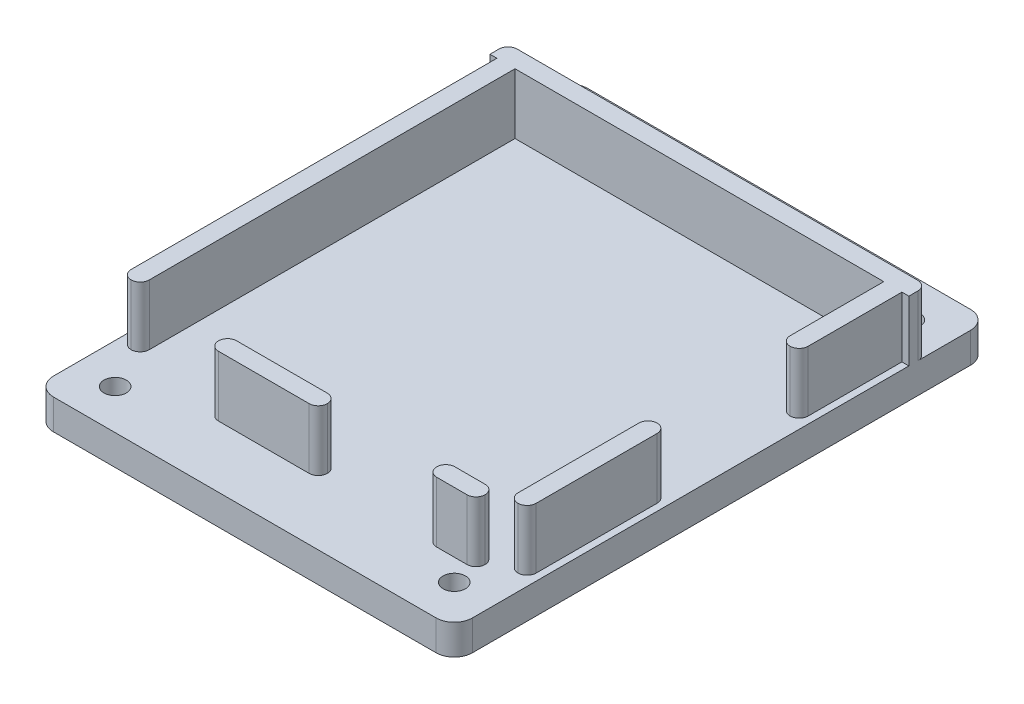
from build123d import *

# Parameters (mm, degrees)
SKETCH_1_W      = 69.3
SKETCH_1_H      = 88.4
SKETCH_1_R      = 1.85
EXTRUDE_1_DEPTH = 5
SKETCH_3_W      = 69.3
SKETCH_3_H      = 3
SKETCH_3_W_2    = 8
SKETCH_3_W_3    = 18
EXTRUDE_2_DEPTH = 10
SKETCH_4_W      = 3
SKETCH_4_H      = 62
SKETCH_4_H_2    = 17
SKETCH_4_H_3    = 23
EXTRUDE_3_DEPTH = 10
FILLET_1_R      = 3
FILLET_2_R      = 1.5
FILLET_3_R      = 1.5


with BuildPart() as part:
    # 草图1 → 凸台-拉伸1 (new body)
    with BuildSketch(Plane(origin=(0, 0, 0), x_dir=(1, 0, 0), z_dir=(0, 1, 0))):
        Rectangle(SKETCH_1_W, SKETCH_1_H)
        with Locations(Location((-28.05, 37.6, 0), (0, 0, 270))):
            Circle(SKETCH_1_R, mode=Mode.SUBTRACT)
        with Locations(Location((28.05, 37.6, 0), (0, 0, 90))):
            Circle(SKETCH_1_R, mode=Mode.SUBTRACT)
        with Locations(Location((28.05, -37.6, 0), (0, 0, 270))):
            Circle(SKETCH_1_R, mode=Mode.SUBTRACT)
        with Locations(Location((-28.05, -37.6, 0), (0, 0, 90))):
            Circle(SKETCH_1_R, mode=Mode.SUBTRACT)
    extrude(amount=-EXTRUDE_1_DEPTH)

    # 草图3 → 凸台-拉伸2 (add)
    with BuildSketch(Plane(origin=(0, 0, 0), x_dir=(1, 0, 0), z_dir=(0, 1, 0))):
        with Locations((0, 32.5)):
            Rectangle(SKETCH_3_W, SKETCH_3_H)
        with Locations((24.05, -32.5)):
            Rectangle(SKETCH_3_W_2, SKETCH_3_H)
        with Locations((-7.05, -32.5)):
            Rectangle(SKETCH_3_W_3, SKETCH_3_H)
    extrude(amount=EXTRUDE_2_DEPTH)

    # 草图4 → 凸台-拉伸3 (add)
    with BuildSketch(Plane(origin=(0, 0, 0), x_dir=(1, 0, 0), z_dir=(0, 1, 0))):
        with Locations((-32, 0)):
            Rectangle(SKETCH_4_W, SKETCH_4_H)
        with Locations((32, 22.5)):
            Rectangle(SKETCH_4_W, SKETCH_4_H_2)
        with Locations((32, -19.5)):
            Rectangle(SKETCH_4_W, SKETCH_4_H_3)
    extrude(amount=EXTRUDE_3_DEPTH)

    # 圆角1
    fillet_1_edges = [part.edges().sort_by_distance(p)[0] for p in [
        (34.65, -2.5, 44.2),
        (-34.65, -2.5, 44.2),
        (-34.65, -2.5, -44.2),
        (34.65, -2.5, -44.2),
    ]]
    fillet(fillet_1_edges, radius=FILLET_1_R)

    # 圆角2
    fillet_2_edges = [part.edges().sort_by_distance(p)[0] for p in [
        (20.05, 5, 34),
        (20.05, 5, 31),
        (28.05, 5, 31),
        (28.05, 5, 34),
        (-16.05, 5, 34),
        (-16.05, 5, 31),
        (1.95, 5, 34),
        (1.95, 5, 31),
    ]]
    fillet(fillet_2_edges, radius=FILLET_2_R - 0.0001)  # a hair under: the kernel refuses the full size

    # 圆角3
    fillet_3_edges = [part.edges().sort_by_distance(p)[0] for p in [
        (34.65, 5, -34),
        (-34.65, 5, -34),
        (-30.5, 5, 31),
        (-33.5, 5, 31),
        (33.5, 5, 31),
        (30.5, 5, 31),
        (33.5, 5, 8),
        (30.5, 5, 8),
        (33.5, 5, -14),
        (30.5, 5, -14),
    ]]
    fillet(fillet_3_edges, radius=FILLET_3_R - 0.0001)  # a hair under: the kernel refuses the full size


solid = part.part
